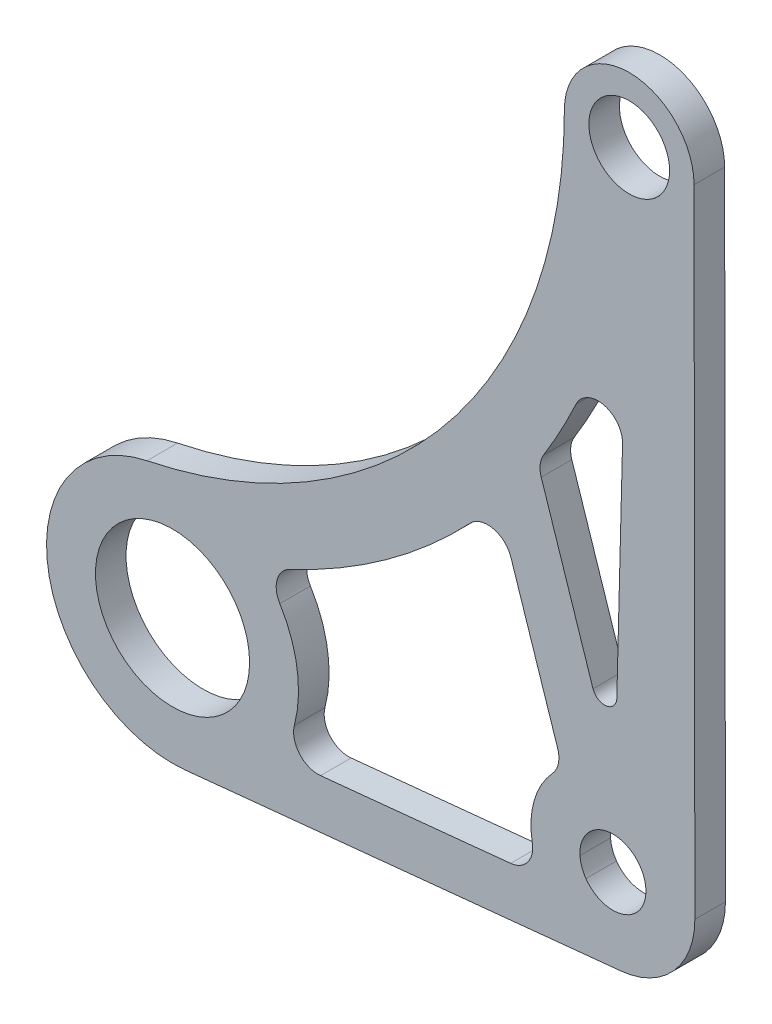
from build123d import *

# Parameters (mm, degrees)
SKETCH2_R           = 8.001
SKETCH2_R_2         = 4.191
SKETCH2_R_3         = 3.429
BOSS_EXTRUDE1_DEPTH = 3.175
FILLET1_R           = 2.54
FILLET2_R           = 2.54
FILLET3_R           = 1.27


with BuildPart() as part:
    # Sketch2 → Boss-Extrude1 (new body)
    with BuildSketch(Plane.XY):
        with BuildLine():
            ThreePointArc((-2.648928174, 12.809985969), (-12.930100198, -1.98117891), (1.3081, -13.015430665))
            Line((1.3081, -13.015430665), (46.5709, -8.466348102))
            ThreePointArc((46.5709, -8.466348102), (52.034102241, -5.703962999), (54.228993002, 0.010912742))
            Line((54.228993002, 0.010912742), (54.144327798, 66.026919496))
            ThreePointArc((54.144327798, 66.026919496), (47.409017099, 72.749285645), (40.682333333, 66.018287029))
            ThreePointArc((40.682333333, 66.018287029), (28.479119875, 31.708224637), (-2.648928174, 12.809985969))
        make_face()
        Circle(SKETCH2_R, mode=Mode.SUBTRACT)
        with BuildLine():
            ThreePointArc((37.904669825, 32.925895635), (44.097273334, 45.567807097), (47.24074359, 59.289500082))
            Line((47.24074359, 59.289500082), (45.938179487, 8.506202367))
            Line((45.938179487, 8.506202367), (37.904669825, 32.925895635))
        make_face(mode=Mode.SUBTRACT)
        with BuildLine():
            ThreePointArc((9.287283979, 9.211889996), (22.6526584, 16.670965095), (33.751929907, 27.210282281))
            Line((33.751929907, 27.210282281), (40.494303148, 6.715293993))
            ThreePointArc((40.494303148, 6.715293993), (37.376046248, 1.667787989), (38.31444276, -4.190561175))
            Line((38.31444276, -4.190561175), (11.09697304, -6.926019806))
            ThreePointArc((11.09697304, -6.926019806), (12.999519866, 1.457753153), (9.287283979, 9.211889996))
        make_face(mode=Mode.SUBTRACT)
        with Locations((47.413333333, 66.018287029)):
            Circle(SKETCH2_R_2, mode=Mode.SUBTRACT)
        with Locations((45.72, 0)):
            Circle(SKETCH2_R_3, mode=Mode.SUBTRACT)
    extrude(amount=BOSS_EXTRUDE1_DEPTH)

    # Fillet1
    fillet1_edges = [part.edges().sort_by_distance(p)[0] for p in [
        (9.287283979, 9.211889996, 1.5875),
        (11.09697304, -6.926019806, 1.5875),
        (38.31444276, -4.190561175, 1.5875),
        (47.24074359, 59.289500082, 1.5875),
    ]]
    fillet(fillet1_edges, radius=FILLET1_R)

    # Fillet2
    fillet2_edges = [part.edges().sort_by_distance(p)[0] for p in [
        (40.494303148, 6.715293993, 1.5875),
        (37.904669825, 32.925895635, 1.5875),
        (33.751929907, 27.210282281, 1.5875),
    ]]
    fillet(fillet2_edges, radius=FILLET2_R)

    # Fillet3
    fillet3_edges = [part.edges().sort_by_distance(p)[0] for p in [
        (45.938179487, 8.506202367, 1.5875),
    ]]
    fillet(fillet3_edges, radius=FILLET3_R)


solid = part.part
